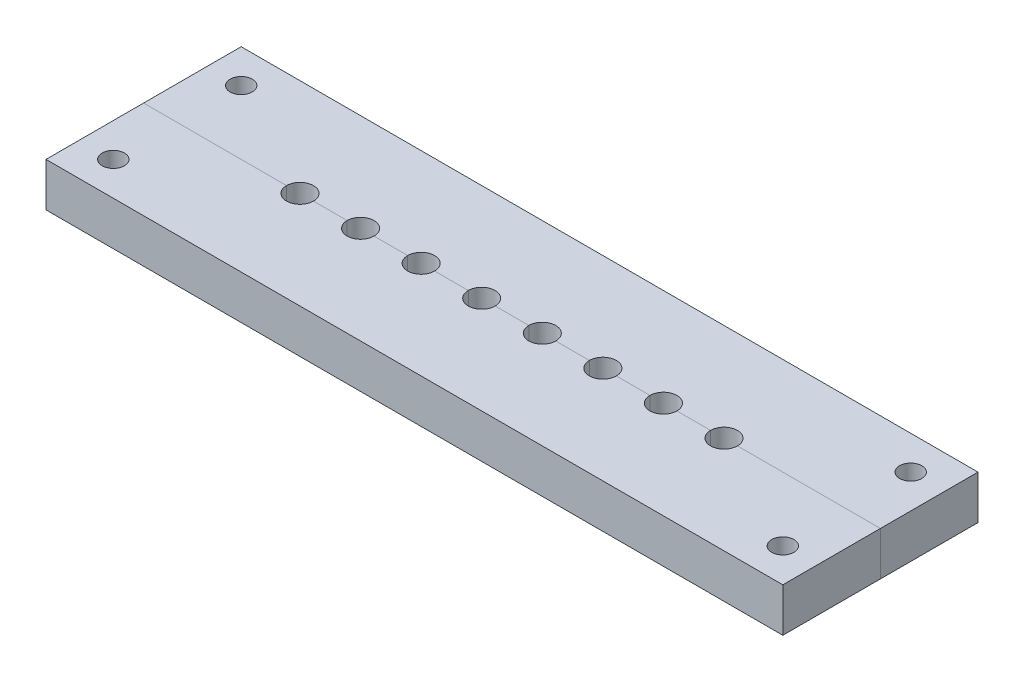
from build123d import *

# Parameters (mm, degrees)
STOCK_OPTICAL_UNIT_V3_1_START         = -22.175
STOCK_OPTICAL_UNIT_V3_1_OUTLINE_W     = 109.48
STOCK_OPTICAL_UNIT_V3_1_OUTLINE_H     = 29
STOCK_OPTICAL_UNIT_V3_1_OUTLINE_R     = 1.65
STOCK_OPTICAL_UNIT_V3_1_OUTLINE_R_2   = 2.725
STOCK_OPTICAL_UNIT_V3_1_DEPTH         = 6.5
STOCK_OPTICAL_UNIT_V3_1_START_2       = -20.675
STOCK_OPTICAL_UNIT_V3_1_2_OUTLINE_R   = 2.725
STOCK_OPTICAL_UNIT_V3_1_2_OUTLINE_R_2 = 2
STOCK_OPTICAL_UNIT_V3_1_2_DEPTH       = 5


# Read off the part's stored shape, not the designer's step: Stock-Optical_unit_v3-1
with BuildPart() as part:
    # Stock-Optical_unit_v3-1 outline → Stock-Optical_unit_v3-1 (new body)
    with BuildSketch(Plane(origin=(0, 0, 0), x_dir=(1, 0, 0), z_dir=(0, 1, 0)).offset(STOCK_OPTICAL_UNIT_V3_1_START)):
        Rectangle(STOCK_OPTICAL_UNIT_V3_1_OUTLINE_W, STOCK_OPTICAL_UNIT_V3_1_OUTLINE_H)
        with Locations((-49.74, -9.5)):
            Circle(STOCK_OPTICAL_UNIT_V3_1_OUTLINE_R, mode=Mode.SUBTRACT)
        with Locations((49.74, -9.5)):
            Circle(STOCK_OPTICAL_UNIT_V3_1_OUTLINE_R, mode=Mode.SUBTRACT)
        with Locations((-31.5, 0)):
            Circle(STOCK_OPTICAL_UNIT_V3_1_OUTLINE_R_2, mode=Mode.SUBTRACT)
        with Locations((-22.5, 0)):
            Circle(STOCK_OPTICAL_UNIT_V3_1_OUTLINE_R_2, mode=Mode.SUBTRACT)
        with Locations((-13.5, 0)):
            Circle(STOCK_OPTICAL_UNIT_V3_1_OUTLINE_R_2, mode=Mode.SUBTRACT)
        with Locations((-4.5, 0)):
            Circle(STOCK_OPTICAL_UNIT_V3_1_OUTLINE_R_2, mode=Mode.SUBTRACT)
        with Locations((-49.74, 9.5)):
            Circle(STOCK_OPTICAL_UNIT_V3_1_OUTLINE_R, mode=Mode.SUBTRACT)
        with Locations((4.5, 0)):
            Circle(STOCK_OPTICAL_UNIT_V3_1_OUTLINE_R_2, mode=Mode.SUBTRACT)
        with Locations((13.5, 0)):
            Circle(STOCK_OPTICAL_UNIT_V3_1_OUTLINE_R_2, mode=Mode.SUBTRACT)
        with Locations((22.5, 0)):
            Circle(STOCK_OPTICAL_UNIT_V3_1_OUTLINE_R_2, mode=Mode.SUBTRACT)
        with Locations((31.5, 0)):
            Circle(STOCK_OPTICAL_UNIT_V3_1_OUTLINE_R_2, mode=Mode.SUBTRACT)
        with Locations((49.74, 9.5)):
            Circle(STOCK_OPTICAL_UNIT_V3_1_OUTLINE_R, mode=Mode.SUBTRACT)
    extrude(amount=STOCK_OPTICAL_UNIT_V3_1_DEPTH)

    # Stock-Optical_unit_v3-1 2 outline → Stock-Optical_unit_v3-1 2 (add)
    # profile 1 of 8: a face of its own
    with BuildSketch(Plane(origin=(0, 0, 0), x_dir=(1, 0, 0), z_dir=(0, 1, 0)).offset(STOCK_OPTICAL_UNIT_V3_1_START_2)):
        with Locations((31.5, 0)):
            Circle(STOCK_OPTICAL_UNIT_V3_1_2_OUTLINE_R)
        with Locations((31.5, 0)):
            Circle(STOCK_OPTICAL_UNIT_V3_1_2_OUTLINE_R_2, mode=Mode.SUBTRACT)
    # profile 2 of 8: a face of its own
    with BuildSketch(Plane(origin=(0, 0, 0), x_dir=(1, 0, 0), z_dir=(0, 1, 0)).offset(STOCK_OPTICAL_UNIT_V3_1_START_2)):
        with Locations((22.5, 0)):
            Circle(STOCK_OPTICAL_UNIT_V3_1_2_OUTLINE_R)
        with Locations((22.5, 0)):
            Circle(STOCK_OPTICAL_UNIT_V3_1_2_OUTLINE_R_2, mode=Mode.SUBTRACT)
    # profile 3 of 8: a face of its own
    with BuildSketch(Plane(origin=(0, 0, 0), x_dir=(1, 0, 0), z_dir=(0, 1, 0)).offset(STOCK_OPTICAL_UNIT_V3_1_START_2)):
        with Locations((13.5, 0)):
            Circle(STOCK_OPTICAL_UNIT_V3_1_2_OUTLINE_R)
        with Locations((13.5, 0)):
            Circle(STOCK_OPTICAL_UNIT_V3_1_2_OUTLINE_R_2, mode=Mode.SUBTRACT)
    # profile 4 of 8: a face of its own
    with BuildSketch(Plane(origin=(0, 0, 0), x_dir=(1, 0, 0), z_dir=(0, 1, 0)).offset(STOCK_OPTICAL_UNIT_V3_1_START_2)):
        with Locations((4.5, 0)):
            Circle(STOCK_OPTICAL_UNIT_V3_1_2_OUTLINE_R)
        with Locations((4.5, 0)):
            Circle(STOCK_OPTICAL_UNIT_V3_1_2_OUTLINE_R_2, mode=Mode.SUBTRACT)
    # profile 5 of 8: a face of its own
    with BuildSketch(Plane(origin=(0, 0, 0), x_dir=(1, 0, 0), z_dir=(0, 1, 0)).offset(STOCK_OPTICAL_UNIT_V3_1_START_2)):
        with Locations((-4.5, 0)):
            Circle(STOCK_OPTICAL_UNIT_V3_1_2_OUTLINE_R)
        with Locations((-4.5, 0)):
            Circle(STOCK_OPTICAL_UNIT_V3_1_2_OUTLINE_R_2, mode=Mode.SUBTRACT)
    # profile 6 of 8: a face of its own
    with BuildSketch(Plane(origin=(0, 0, 0), x_dir=(1, 0, 0), z_dir=(0, 1, 0)).offset(STOCK_OPTICAL_UNIT_V3_1_START_2)):
        with Locations((-13.5, 0)):
            Circle(STOCK_OPTICAL_UNIT_V3_1_2_OUTLINE_R)
        with Locations((-13.5, 0)):
            Circle(STOCK_OPTICAL_UNIT_V3_1_2_OUTLINE_R_2, mode=Mode.SUBTRACT)
    # profile 7 of 8: a face of its own
    with BuildSketch(Plane(origin=(0, 0, 0), x_dir=(1, 0, 0), z_dir=(0, 1, 0)).offset(STOCK_OPTICAL_UNIT_V3_1_START_2)):
        with Locations((-22.5, 0)):
            Circle(STOCK_OPTICAL_UNIT_V3_1_2_OUTLINE_R)
        with Locations((-22.5, 0)):
            Circle(STOCK_OPTICAL_UNIT_V3_1_2_OUTLINE_R_2, mode=Mode.SUBTRACT)
    # profile 8 of 8: a face of its own
    with BuildSketch(Plane(origin=(0, 0, 0), x_dir=(1, 0, 0), z_dir=(0, 1, 0)).offset(STOCK_OPTICAL_UNIT_V3_1_START_2)):
        with Locations((-31.5, 0)):
            Circle(STOCK_OPTICAL_UNIT_V3_1_2_OUTLINE_R)
        with Locations((-31.5, 0)):
            Circle(STOCK_OPTICAL_UNIT_V3_1_2_OUTLINE_R_2, mode=Mode.SUBTRACT)
    extrude(amount=STOCK_OPTICAL_UNIT_V3_1_2_DEPTH)


with BuildPart() as body_2:
    # Split1: the piece on the far side of the plane
    add(part.part)
    split(bisect_by=Plane.XY, keep=Keep.BOTTOM)


with BuildPart() as part_1:
    add(part.part)

    # Split1
    split(bisect_by=Plane.XY, keep=Keep.TOP)


solid = Compound([body_2.part, part_1.part])
